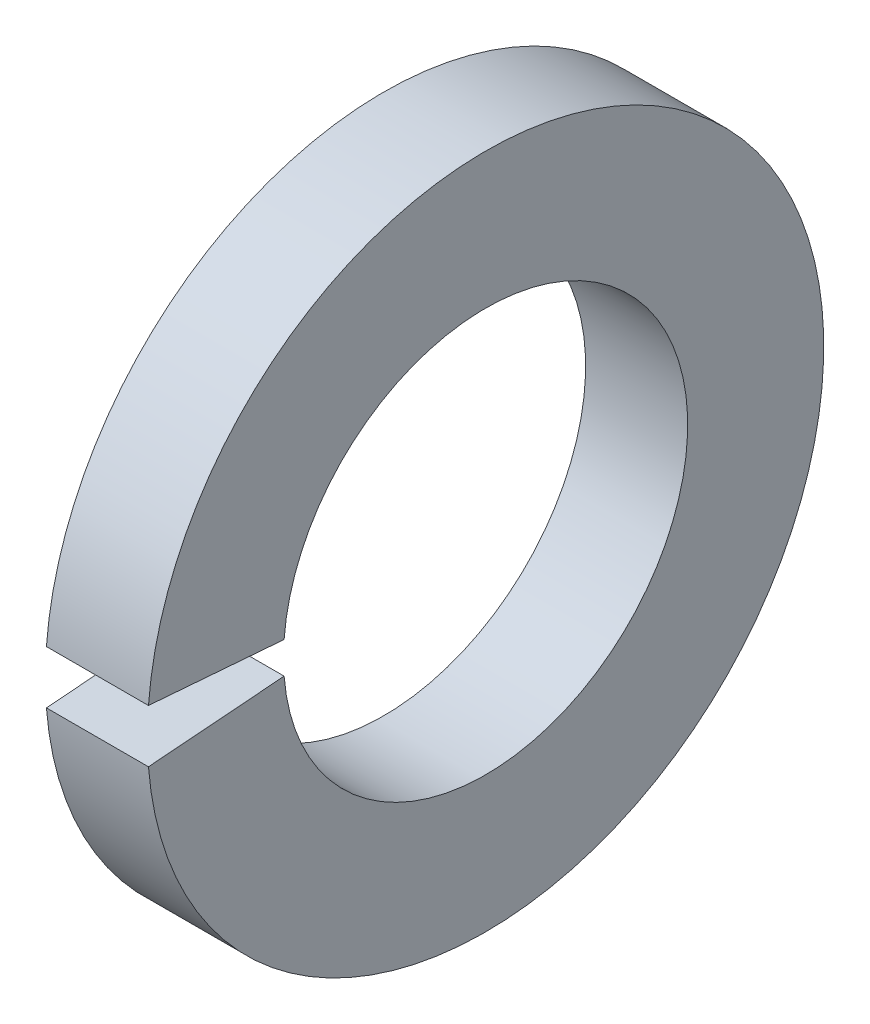
from build123d import *

# Parameters (mm, degrees)
SKETCH1_W = 5.1
SKETCH1_H = 6.8
GAP_DEPTH = 25.438289629


with BuildPart() as part:
    # Sketch1 → Base-Revolve (revolve)
    with BuildSketch(Plane.XY):
        with Locations((-2.55, 13.5)):
            Rectangle(SKETCH1_W, SKETCH1_H)
    revolve(axis=Axis((-34.925, 0, 0), (1, 0, 0)))

    # Sketch2 → Gap (cut, through all)
    with BuildSketch(Plane(origin=(0, 0, 0), x_dir=(0, -1, 0), z_dir=(-1, 0, 0))):
        with BuildLine():
            Line((0, 0), (1.352477892, 17.184860999))
            ThreePointArc((1.352477892, 17.184860999), (0, 17.238), (-1.352477892, 17.184860999))
            Line((-1.352477892, 17.184860999), (0, 0))
        make_face()
    extrude(amount=GAP_DEPTH, mode=Mode.SUBTRACT)


solid = part.part
